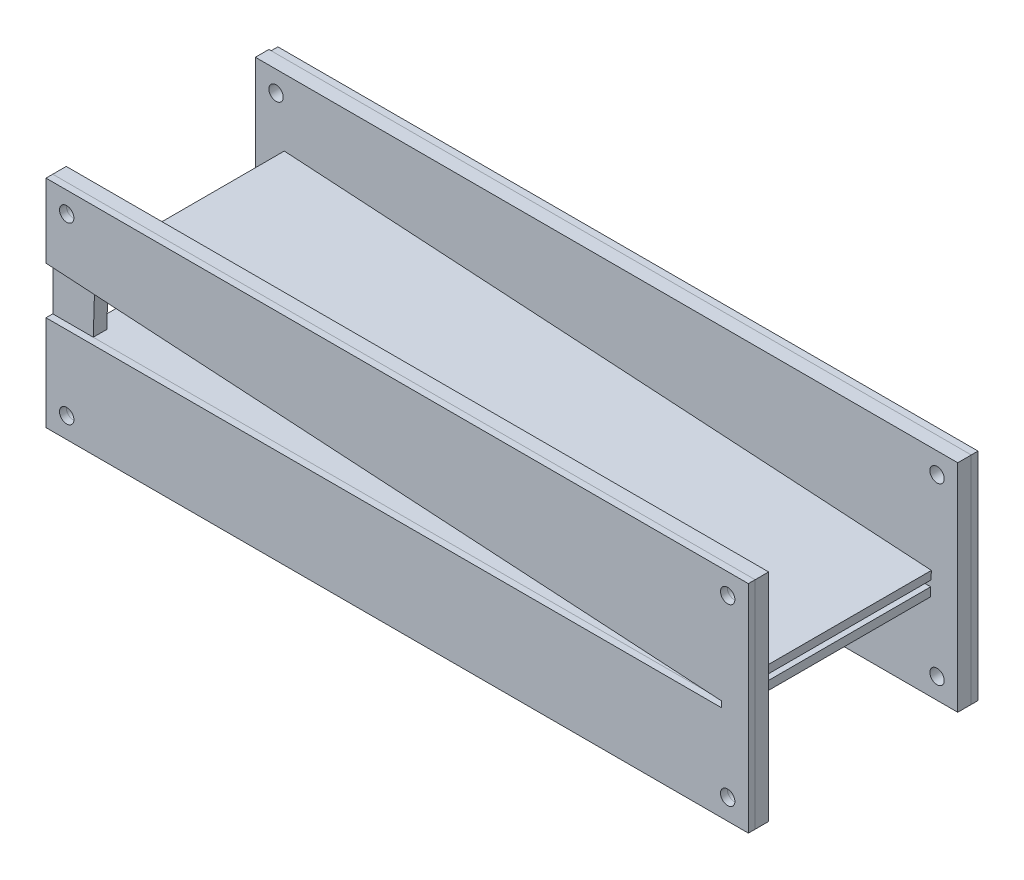
from build123d import *

# Parameters (mm, degrees)
SKETCH1_W               = 330.2
SKETCH1_H               = 101.6
BOSS_EXTRUDE1_DEPTH     = 3.175
BOSS_EXTRUDE3_DEPTH     = 3.175
BOSS_EXTRUDE4_DEPTH     = 101.6
SKETCH3_W               = 304.8
SKETCH3_H               = 4.064
BOSS_EXTRUDE4_2_DEPTH   = 101.6
MIRROR2_START           = -98.425
MIRROR2_OUTLINE_W       = 330.2
MIRROR2_OUTLINE_H       = 101.6
MIRROR2_DEPTH           = 6.35
SKETCH7_W               = 329.139579846
SKETCH7_H               = 101.6
BOSS_EXTRUDE6_DEPTH     = 3.175
CUT_EXTRUDE1_START      = -163.576
SKETCH6_R               = 3.3782
CUT_EXTRUDE1_DEPTH      = 368.271489641
MIRROR4_START           = -163.576
MIRROR4_COPY_1_SKETCH_R = 3.3782
MIRROR4_COPY_1_DEPTH    = 368.271489641


# Read off the part's stored shape, not the designer's step: Mirror2
with BuildPart() as part:
    # Sketch1 → Boss-Extrude1 (new body)
    with BuildSketch(Plane.XY):
        Rectangle(SKETCH1_W, SKETCH1_H)
        Polygon((152.733443083, 0.795505086), (-151.498043476, 19.403099936), (-151.746144741, 15.346680116), (-145.407988771, 14.959021889), (-146.05, -6.054174947), (-152.4, -6.054174947), (-152.4, -10.118174947), (152.4, -10.118174947), (152.4, -6.054174947), (146.17120335, -6.054174947), (146.268163129, -2.880655796), (152.485341818, -3.260914735), align=None, mode=Mode.SUBTRACT)
    boss_extrude1 = extrude(amount=BOSS_EXTRUDE1_DEPTH)

    # Mirror1: Boss-Extrude1 across Front Plane
    add(boss_extrude1.mirror(Plane.XY))


with BuildPart() as body_2:
    # Sketch2 → Boss-Extrude3 (new body)
    with BuildSketch(Plane.XY.offset(3.175)):
        Polygon((-165.1, 16.163436892), (152.485341818, -3.260914735), (152.4, -6.054174947), (-165.1, -6.054174947), (-165.1, -50.8), (165.1, -50.8), (165.1, 50.8), (-165.1, 50.8), align=None)
    extrude(amount=BOSS_EXTRUDE3_DEPTH)


with BuildPart() as body_3:
    # Sketch3 → Boss-Extrude4 (new body)
    with BuildSketch(Plane(origin=(0, 0, 3.175), x_dir=(-1, 0, 0), z_dir=(0, 0, -1))):
        Polygon((-152.733443083, 0.795505086), (-152.485341818, -3.260914735), (151.746144741, 15.346680116), (151.498043476, 19.403099936), align=None)
    extrude(amount=BOSS_EXTRUDE4_DEPTH)


with BuildPart() as body_4:
    # Sketch3 → Boss-Extrude4 2 (new body)
    with BuildSketch(Plane(origin=(0, 0, 3.175), x_dir=(-1, 0, 0), z_dir=(0, 0, -1))):
        with Locations((0, -8.086174947)):
            Rectangle(SKETCH3_W, SKETCH3_H)
    extrude(amount=BOSS_EXTRUDE4_2_DEPTH)


with BuildPart() as body_5:
    # Mirror2 outline → Mirror2 (new body)
    with BuildSketch(Plane.XY.offset(MIRROR2_START)):
        Rectangle(MIRROR2_OUTLINE_W, MIRROR2_OUTLINE_H)
        Polygon((-151.498043476, 19.403099936), (152.733443083, 0.795505086), (152.485341818, -3.260914735), (146.268163129, -2.880655796), (146.17120335, -6.054174947), (152.4, -6.054174947), (152.4, -10.118174947), (-152.4, -10.118174947), (-152.4, -6.054174947), (-146.05, -6.054174947), (-145.407988771, 14.959021889), (-151.746144741, 15.346680116), align=None, mode=Mode.SUBTRACT)
    extrude(amount=MIRROR2_DEPTH)


with BuildPart() as body_6:
    # Sketch7 → Boss-Extrude6 (new body)
    with BuildSketch(Plane(origin=(0, 0, -98.425), x_dir=(-1, 0, 0), z_dir=(0, 0, -1))):
        with Locations((-0.530210077, 0)):
            Rectangle(SKETCH7_W, SKETCH7_H)
    extrude(amount=BOSS_EXTRUDE6_DEPTH)


with BuildPart() as cut_extrude1_tool:
    # Sketch6 → Cut-Extrude1 (new body)
    with BuildSketch(Plane(origin=(0, 0, -101.6), x_dir=(-1, 0, 0), z_dir=(0, 0, -1)).offset(CUT_EXTRUDE1_START)):
        with Locations(Location((-155.3718, 41.0718, 0), (0, 0, 180))):
            Circle(SKETCH6_R)
    cut_extrude1 = extrude(amount=CUT_EXTRUDE1_DEPTH)


with BuildPart() as part_1:
    add(part.part)

    # Cut-Extrude1: cut by cut_extrude1_tool
    add(cut_extrude1_tool.part, mode=Mode.SUBTRACT)


with BuildPart() as body_2_1:
    add(body_2.part)

    # Cut-Extrude1: cut by cut_extrude1_tool
    add(cut_extrude1_tool.part, mode=Mode.SUBTRACT)


with BuildPart() as body_5_1:
    add(body_5.part)

    # Cut-Extrude1: cut by cut_extrude1_tool
    add(cut_extrude1_tool.part, mode=Mode.SUBTRACT)


with BuildPart() as body_6_1:
    add(body_6.part)

    # Cut-Extrude1: cut by cut_extrude1_tool
    add(cut_extrude1_tool.part, mode=Mode.SUBTRACT)


with BuildPart() as mirror3_tool:
    # Mirror3: Cut-Extrude1 across plane
    add(cut_extrude1.mirror(Plane(origin=(0, 0, 0), x_dir=(0, 0, 1), z_dir=(1, 0, 0))))


with BuildPart() as part_2:
    add(part_1.part)

    # Mirror3: cut by mirror3_tool
    add(mirror3_tool.part, mode=Mode.SUBTRACT)


with BuildPart() as body_2_2:
    add(body_2_1.part)

    # Mirror3: cut by mirror3_tool
    add(mirror3_tool.part, mode=Mode.SUBTRACT)


with BuildPart() as body_5_2:
    add(body_5_1.part)

    # Mirror3: cut by mirror3_tool
    add(mirror3_tool.part, mode=Mode.SUBTRACT)


with BuildPart() as body_6_2:
    add(body_6_1.part)

    # Mirror3: cut by mirror3_tool
    add(mirror3_tool.part, mode=Mode.SUBTRACT)


with BuildPart() as mirror4_tool:
    # Mirror4: Cut-Extrude1 across plane
    add(cut_extrude1.mirror(Plane.ZX))


with BuildPart() as part_3:
    add(part_2.part)

    # Mirror4: cut by mirror4_tool
    add(mirror4_tool.part, mode=Mode.SUBTRACT)


with BuildPart() as body_2_3:
    add(body_2_2.part)

    # Mirror4: cut by mirror4_tool
    add(mirror4_tool.part, mode=Mode.SUBTRACT)


with BuildPart() as body_5_3:
    add(body_5_2.part)

    # Mirror4: cut by mirror4_tool
    add(mirror4_tool.part, mode=Mode.SUBTRACT)


with BuildPart() as body_6_3:
    add(body_6_2.part)

    # Mirror4: cut by mirror4_tool
    add(mirror4_tool.part, mode=Mode.SUBTRACT)


with BuildPart() as mirror4_copy_1_tool:
    # Mirror4 copy 1 sketch → Mirror4 copy 1 (new body)
    with BuildSketch(Plane(origin=(0, 0, -101.6), x_dir=(1, 0, 0), z_dir=(0, 0, -1)).offset(MIRROR4_START)):
        with Locations(Location((-155.3718, 41.0718, 0), (0, 0, 180))):
            Circle(MIRROR4_COPY_1_SKETCH_R)
    extrude(amount=MIRROR4_COPY_1_DEPTH)


with BuildPart() as part_4:
    add(part_3.part)

    # Mirror4 copy 1: cut by mirror4_copy_1_tool
    add(mirror4_copy_1_tool.part, mode=Mode.SUBTRACT)


with BuildPart() as body_2_4:
    add(body_2_3.part)

    # Mirror4 copy 1: cut by mirror4_copy_1_tool
    add(mirror4_copy_1_tool.part, mode=Mode.SUBTRACT)


with BuildPart() as body_5_4:
    add(body_5_3.part)

    # Mirror4 copy 1: cut by mirror4_copy_1_tool
    add(mirror4_copy_1_tool.part, mode=Mode.SUBTRACT)


with BuildPart() as body_6_4:
    add(body_6_3.part)

    # Mirror4 copy 1: cut by mirror4_copy_1_tool
    add(mirror4_copy_1_tool.part, mode=Mode.SUBTRACT)


solid = Compound([body_3.part, body_4.part, part_4.part, body_2_4.part, body_5_4.part, body_6_4.part])
